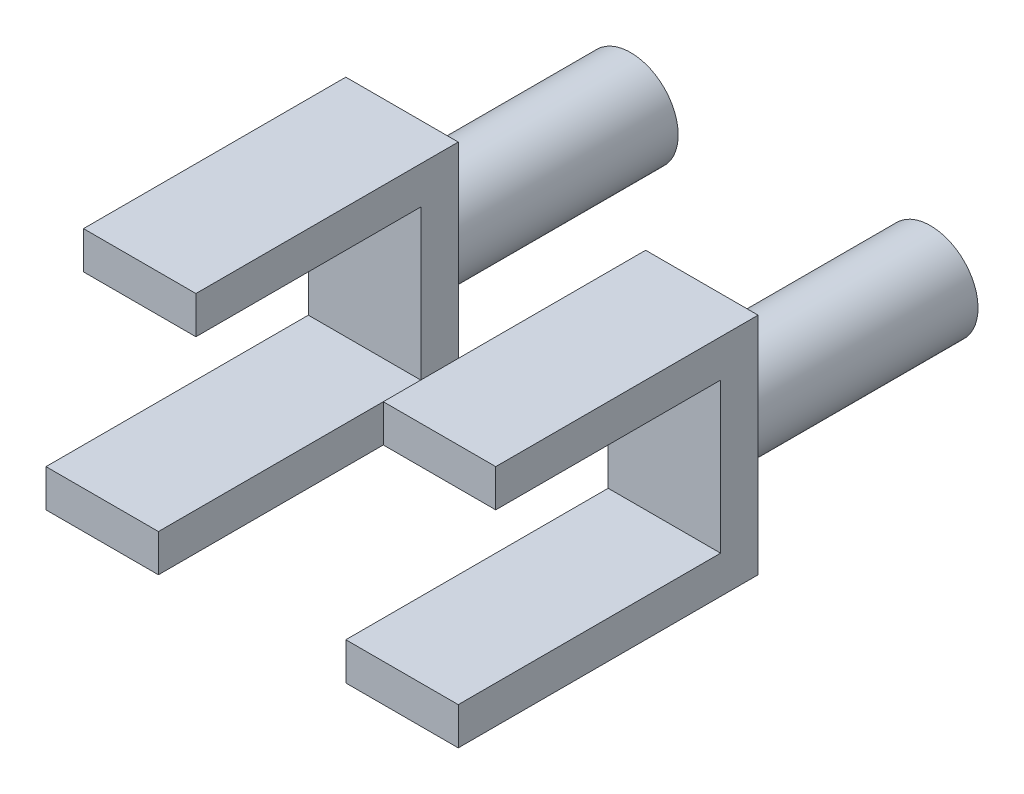
from build123d import *

# Parameters (mm, degrees)
EXTRUDE_THIN1_DEPTH       = 30
SKETCH2_R                 = 12.029231033
BOSS_EXTRUDE1_DEPTH       = 2
BOSS_EXTRUDE1_TAPER       = 10
BOSS_EXTRUDE3_OUTLINE_R   = 12.686013659
BOSS_EXTRUDE3_OUTLINE_R_2 = 12.264492206
BOSS_EXTRUDE3_OUTLINE_R_3 = 1.25
BOSS_EXTRUDE3_DEPTH       = 59


# Read off the part's stored shape, not the designer's step: Boss-Extrude3
with BuildPart() as part:
    # Sketch1 → Extrude-Thin1 (new body)
    with BuildSketch(Plane(origin=(0, 0, 0), x_dir=(0, 0, -1), z_dir=(1, 0, 0))):
        Polygon((-25.251798561, 0.287769784), (34.748201439, 0.287769784), (34.748201439, -39.712230216), (-35.251798561, -39.712230216), (-35.251798561, -49.712230216), (44.748201439, -49.712230216), (44.748201439, 10.287769784), (-25.251798561, 10.287769784), align=None)
    extrude(amount=EXTRUDE_THIN1_DEPTH)

    # Sketch2 → Boss-Extrude1 (add)
    with BuildSketch(Plane(origin=(0, 0, -44.748201439), x_dir=(-1, 0, 0), z_dir=(0, 0, -1))):
        with Locations((-15, -19.712230216)):
            Circle(SKETCH2_R)
    extrude(amount=BOSS_EXTRUDE1_DEPTH, taper=BOSS_EXTRUDE1_TAPER)

    # Boss-Extrude3 outline → Boss-Extrude3 (add)
    # profile 1 of 34: a face of its own
    with BuildSketch(Plane(origin=(0, 0, -46.748201439), x_dir=(-1, 0, 0), z_dir=(0, 0, -1))):
        with Locations((-15, -19.712230216)):
            Circle(BOSS_EXTRUDE3_OUTLINE_R)
        with Locations((-15, -19.712230216)):
            Circle(BOSS_EXTRUDE3_OUTLINE_R_2, mode=Mode.SUBTRACT)
    # profile 2 of 34: a face of its own
    with BuildSketch(Plane(origin=(0, 0, -46.748201439), x_dir=(-1, 0, 0), z_dir=(0, 0, -1))):
        with Locations((-22.075480808, -14.368464662)):
            Circle(BOSS_EXTRUDE3_OUTLINE_R_3)
    # profile 3 of 34: a face of its own
    with BuildSketch(Plane(origin=(0, 0, -46.748201439), x_dir=(-1, 0, 0), z_dir=(0, 0, -1))):
        with Locations((-18.584105526, -11.202243012)):
            Circle(BOSS_EXTRUDE3_OUTLINE_R_3)
    # profile 4 of 34: a face of its own
    with BuildSketch(Plane(origin=(0, 0, -46.748201439), x_dir=(-1, 0, 0), z_dir=(0, 0, -1))):
        with Locations((-18.584105526, -14.368464662)):
            Circle(BOSS_EXTRUDE3_OUTLINE_R_3)
    # profile 5 of 34: a face of its own
    with BuildSketch(Plane(origin=(0, 0, -46.748201439), x_dir=(-1, 0, 0), z_dir=(0, 0, -1))):
        with Locations((-15.092730244, -11.202243012)):
            Circle(BOSS_EXTRUDE3_OUTLINE_R_3)
    # profile 6 of 34: a face of its own
    with BuildSketch(Plane(origin=(0, 0, -46.748201439), x_dir=(-1, 0, 0), z_dir=(0, 0, -1))):
        with Locations((-11.672152515, -11.202243012)):
            Circle(BOSS_EXTRUDE3_OUTLINE_R_3)
    # profile 7 of 34: a face of its own
    with BuildSketch(Plane(origin=(0, 0, -46.748201439), x_dir=(-1, 0, 0), z_dir=(0, 0, -1))):
        with Locations((-15.092730244, -14.368464662)):
            Circle(BOSS_EXTRUDE3_OUTLINE_R_3)
    # profile 8 of 34: a face of its own
    with BuildSketch(Plane(origin=(0, 0, -46.748201439), x_dir=(-1, 0, 0), z_dir=(0, 0, -1))):
        with Locations((-11.672152515, -14.368464662)):
            Circle(BOSS_EXTRUDE3_OUTLINE_R_3)
    # profile 9 of 34: a face of its own
    with BuildSketch(Plane(origin=(0, 0, -46.748201439), x_dir=(-1, 0, 0), z_dir=(0, 0, -1))):
        with Locations((-8.251574787, -14.368464662)):
            Circle(BOSS_EXTRUDE3_OUTLINE_R_3)
    # profile 10 of 34: a face of its own
    with BuildSketch(Plane(origin=(0, 0, -46.748201439), x_dir=(-1, 0, 0), z_dir=(0, 0, -1))):
        with Locations((-4.830997058, -17.534686312)):
            Circle(BOSS_EXTRUDE3_OUTLINE_R_3)
    # profile 11 of 34: a face of its own
    with BuildSketch(Plane(origin=(0, 0, -46.748201439), x_dir=(-1, 0, 0), z_dir=(0, 0, -1))):
        with Locations((-8.251574787, -17.534686312)):
            Circle(BOSS_EXTRUDE3_OUTLINE_R_3)
    # profile 12 of 34: a face of its own
    with BuildSketch(Plane(origin=(0, 0, -46.748201439), x_dir=(-1, 0, 0), z_dir=(0, 0, -1))):
        with Locations((-11.672152515, -17.534686312)):
            Circle(BOSS_EXTRUDE3_OUTLINE_R_3)
    # profile 13 of 34: a face of its own
    with BuildSketch(Plane(origin=(0, 0, -46.748201439), x_dir=(-1, 0, 0), z_dir=(0, 0, -1))):
        with Locations((-15.092730244, -17.534686312)):
            Circle(BOSS_EXTRUDE3_OUTLINE_R_3)
    # profile 14 of 34: a face of its own
    with BuildSketch(Plane(origin=(0, 0, -46.748201439), x_dir=(-1, 0, 0), z_dir=(0, 0, -1))):
        with Locations((-18.584105526, -17.534686312)):
            Circle(BOSS_EXTRUDE3_OUTLINE_R_3)
    # profile 15 of 34: a face of its own
    with BuildSketch(Plane(origin=(0, 0, -46.748201439), x_dir=(-1, 0, 0), z_dir=(0, 0, -1))):
        with Locations((-22.075480808, -17.534686312)):
            Circle(BOSS_EXTRUDE3_OUTLINE_R_3)
    # profile 16 of 34: a face of its own
    with BuildSketch(Plane(origin=(0, 0, -46.748201439), x_dir=(-1, 0, 0), z_dir=(0, 0, -1))):
        with Locations((-22.075480808, -20.700907963)):
            Circle(BOSS_EXTRUDE3_OUTLINE_R_3)
    # profile 17 of 34: a face of its own
    with BuildSketch(Plane(origin=(0, 0, -46.748201439), x_dir=(-1, 0, 0), z_dir=(0, 0, -1))):
        with Locations((-18.584105526, -20.700907963)):
            Circle(BOSS_EXTRUDE3_OUTLINE_R_3)
    # profile 18 of 34: a face of its own
    with BuildSketch(Plane(origin=(0, 0, -46.748201439), x_dir=(-1, 0, 0), z_dir=(0, 0, -1))):
        with Locations((-15.092730244, -20.700907963)):
            Circle(BOSS_EXTRUDE3_OUTLINE_R_3)
    # profile 19 of 34: a face of its own
    with BuildSketch(Plane(origin=(0, 0, -46.748201439), x_dir=(-1, 0, 0), z_dir=(0, 0, -1))):
        with Locations((-11.672152515, -20.700907963)):
            Circle(BOSS_EXTRUDE3_OUTLINE_R_3)
    # profile 20 of 34: a face of its own
    with BuildSketch(Plane(origin=(0, 0, -46.748201439), x_dir=(-1, 0, 0), z_dir=(0, 0, -1))):
        with Locations((-8.251574787, -20.700907963)):
            Circle(BOSS_EXTRUDE3_OUTLINE_R_3)
    # profile 21 of 34: a face of its own
    with BuildSketch(Plane(origin=(0, 0, -46.748201439), x_dir=(-1, 0, 0), z_dir=(0, 0, -1))):
        with Locations((-4.830997058, -20.700907963)):
            Circle(BOSS_EXTRUDE3_OUTLINE_R_3)
    # profile 22 of 34: a face of its own
    with BuildSketch(Plane(origin=(0, 0, -46.748201439), x_dir=(-1, 0, 0), z_dir=(0, 0, -1))):
        with Locations((-8.251574787, -23.867129613)):
            Circle(BOSS_EXTRUDE3_OUTLINE_R_3)
    # profile 23 of 34: a face of its own
    with BuildSketch(Plane(origin=(0, 0, -46.748201439), x_dir=(-1, 0, 0), z_dir=(0, 0, -1))):
        with Locations((-11.672152515, -23.867129613)):
            Circle(BOSS_EXTRUDE3_OUTLINE_R_3)
    # profile 24 of 34: a face of its own
    with BuildSketch(Plane(origin=(0, 0, -46.748201439), x_dir=(-1, 0, 0), z_dir=(0, 0, -1))):
        with Locations((-15.092730244, -23.867129613)):
            Circle(BOSS_EXTRUDE3_OUTLINE_R_3)
    # profile 25 of 34: a face of its own
    with BuildSketch(Plane(origin=(0, 0, -46.748201439), x_dir=(-1, 0, 0), z_dir=(0, 0, -1))):
        with Locations((-18.584105526, -23.867129613)):
            Circle(BOSS_EXTRUDE3_OUTLINE_R_3)
    # profile 26 of 34: a face of its own
    with BuildSketch(Plane(origin=(0, 0, -46.748201439), x_dir=(-1, 0, 0), z_dir=(0, 0, -1))):
        with Locations((-22.075480808, -23.867129613)):
            Circle(BOSS_EXTRUDE3_OUTLINE_R_3)
    # profile 27 of 34: a face of its own
    with BuildSketch(Plane(origin=(0, 0, -46.748201439), x_dir=(-1, 0, 0), z_dir=(0, 0, -1))):
        with Locations((-22.075480808, -27.033351263)):
            Circle(BOSS_EXTRUDE3_OUTLINE_R_3)
    # profile 28 of 34: a face of its own
    with BuildSketch(Plane(origin=(0, 0, -46.748201439), x_dir=(-1, 0, 0), z_dir=(0, 0, -1))):
        with Locations((-18.584105526, -27.033351263)):
            Circle(BOSS_EXTRUDE3_OUTLINE_R_3)
    # profile 29 of 34: a face of its own
    with BuildSketch(Plane(origin=(0, 0, -46.748201439), x_dir=(-1, 0, 0), z_dir=(0, 0, -1))):
        with Locations((-15.092730244, -27.033351263)):
            Circle(BOSS_EXTRUDE3_OUTLINE_R_3)
    # profile 30 of 34: a face of its own
    with BuildSketch(Plane(origin=(0, 0, -46.748201439), x_dir=(-1, 0, 0), z_dir=(0, 0, -1))):
        with BuildLine():
            ThreePointArc((-15.510664722, -31.377635209), (-15.10324155, -31.38835086), (-14.695692597, -31.384841282))
            ThreePointArc((-14.695692597, -31.384841282), (-15.08167804, -28.949621775), (-15.510664722, -31.377635209))
        make_face()
    # profile 31 of 34: a face of its own
    with BuildSketch(Plane(origin=(0, 0, -46.748201439), x_dir=(-1, 0, 0), z_dir=(0, 0, -1))):
        with Locations((-11.672152515, -27.033351263)):
            Circle(BOSS_EXTRUDE3_OUTLINE_R_3)
    # profile 32 of 34: a face of its own
    with BuildSketch(Plane(origin=(0, 0, -46.748201439), x_dir=(-1, 0, 0), z_dir=(0, 0, -1))):
        with Locations((-8.251574787, -27.033351263)):
            Circle(BOSS_EXTRUDE3_OUTLINE_R_3)
    # profile 33 of 34: a face of its own
    with BuildSketch(Plane(origin=(0, 0, -46.748201439), x_dir=(-1, 0, 0), z_dir=(0, 0, -1))):
        with Locations((-25.566856091, -17.534686312)):
            Circle(BOSS_EXTRUDE3_OUTLINE_R_3)
    # profile 34 of 34: a face of its own
    with BuildSketch(Plane(origin=(0, 0, -46.748201439), x_dir=(-1, 0, 0), z_dir=(0, 0, -1))):
        with Locations((-25.566856091, -20.700907963)):
            Circle(BOSS_EXTRUDE3_OUTLINE_R_3)
    extrude(amount=BOSS_EXTRUDE3_DEPTH)


with BuildPart() as body_2:
    # Body-Move/Copy1: copy of part
    add(part.part.moved(Location((-80, 0, 0))))


solid = Compound([part.part, body_2.part])
